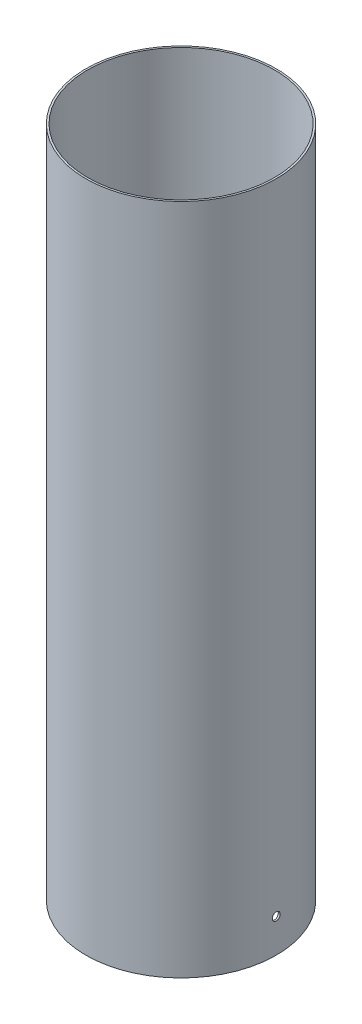
from build123d import *

# Parameters (mm, degrees)
SKETCH_1_R               = 51
SKETCH_1_R_2             = 50
EXTRUDE_1_DEPTH          = 360
CUT_EXTRUDE_1_DEPTH      = 116
CUT_EXTRUDE_1_DEPTH_BACK = 129
SKETCH_2_R               = 2.1


with BuildPart() as part:
    # Эскиз1 → Бобышка-Вытянуть1 (new body)
    with BuildSketch(Plane(origin=(0, 0, 0), x_dir=(1, 0, 0), z_dir=(0, 1, 0))):
        Circle(SKETCH_1_R)
        Circle(SKETCH_1_R_2, mode=Mode.SUBTRACT)
    extrude(amount=EXTRUDE_1_DEPTH)

    # Эскиз2 → Вырез-Вытянуть1 (cut, two sides: drawn at the far end of the back side and taken through both)
    with BuildSketch(Plane(origin=(0, 0, 0), x_dir=(0, 0, -1), z_dir=(1, 0, 0)).offset(-CUT_EXTRUDE_1_DEPTH_BACK)):
        with Locations((0, 18)):
            Circle(SKETCH_2_R)
    extrude(amount=CUT_EXTRUDE_1_DEPTH + CUT_EXTRUDE_1_DEPTH_BACK, mode=Mode.SUBTRACT)


solid = part.part
